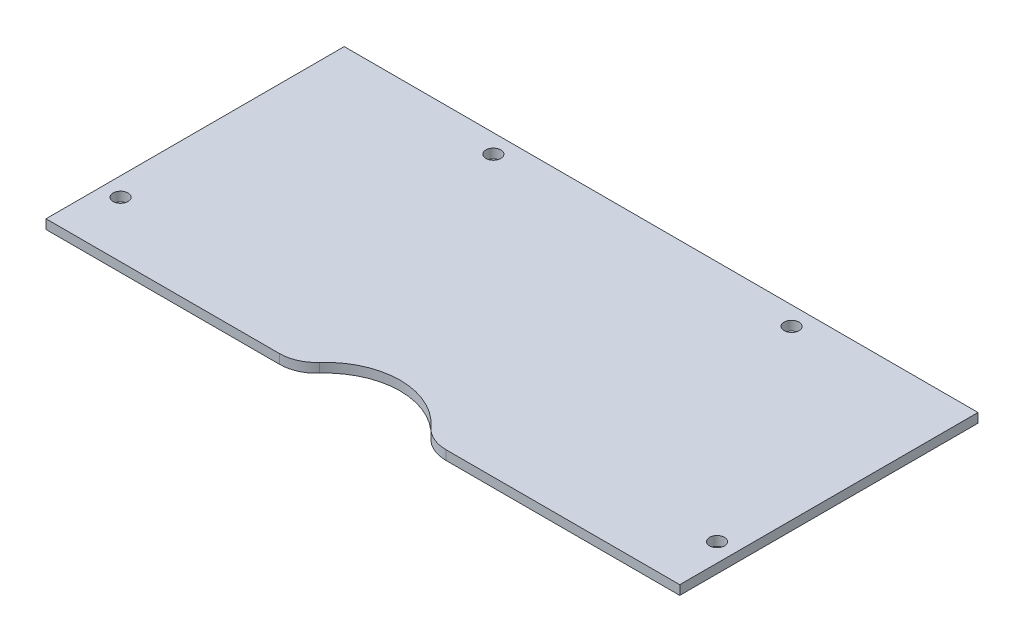
from build123d import *

# Parameters (mm, degrees)
BOSS_EXTRUDE1_DEPTH = 3.175
FILLET1_R           = 12.7
SKETCH2_R           = 2.54
CUT_EXTRUDE1_DEPTH  = 315.453256661


with BuildPart() as part:
    # Sketch1 → Boss-Extrude1 (new body)
    with BuildSketch(Plane(origin=(0, 0, 0), x_dir=(1, 0, 0), z_dir=(0, 1, 0))):
        with BuildLine():
            Line((0, 228.6), (0, 127))
            Line((0, 127), (85.952954744, 127))
            ThreePointArc((85.952954744, 127), (107.95, 139.7), (129.947045256, 127))
            Line((129.947045256, 127), (215.9, 127))
            Line((215.9, 127), (215.9, 228.6))
            Line((215.9, 228.6), (0, 228.6))
        make_face()
    extrude(amount=BOSS_EXTRUDE1_DEPTH)

    # Fillet1
    fillet1_edges = [part.edges().sort_by_distance(p)[0] for p in [
        (129.947045256, 1.5875, -127),
        (85.952954744, 1.5875, -127),
    ]]
    fillet(fillet1_edges, radius=FILLET1_R)

    # Sketch2 → Cut-Extrude1 (cut, through all)
    with BuildSketch(Plane(origin=(0, 3.175, 0), x_dir=(1, 0, 0), z_dir=(0, 1, 0))):
        with Locations((6.35, 146.05)):
            Circle(SKETCH2_R)
        with Locations((57.15, 222.25)):
            Circle(SKETCH2_R)
        with Locations((158.75, 222.25)):
            Circle(SKETCH2_R)
        with Locations((209.55, 146.05)):
            Circle(SKETCH2_R)
    extrude(amount=-CUT_EXTRUDE1_DEPTH, mode=Mode.SUBTRACT)


solid = part.part
